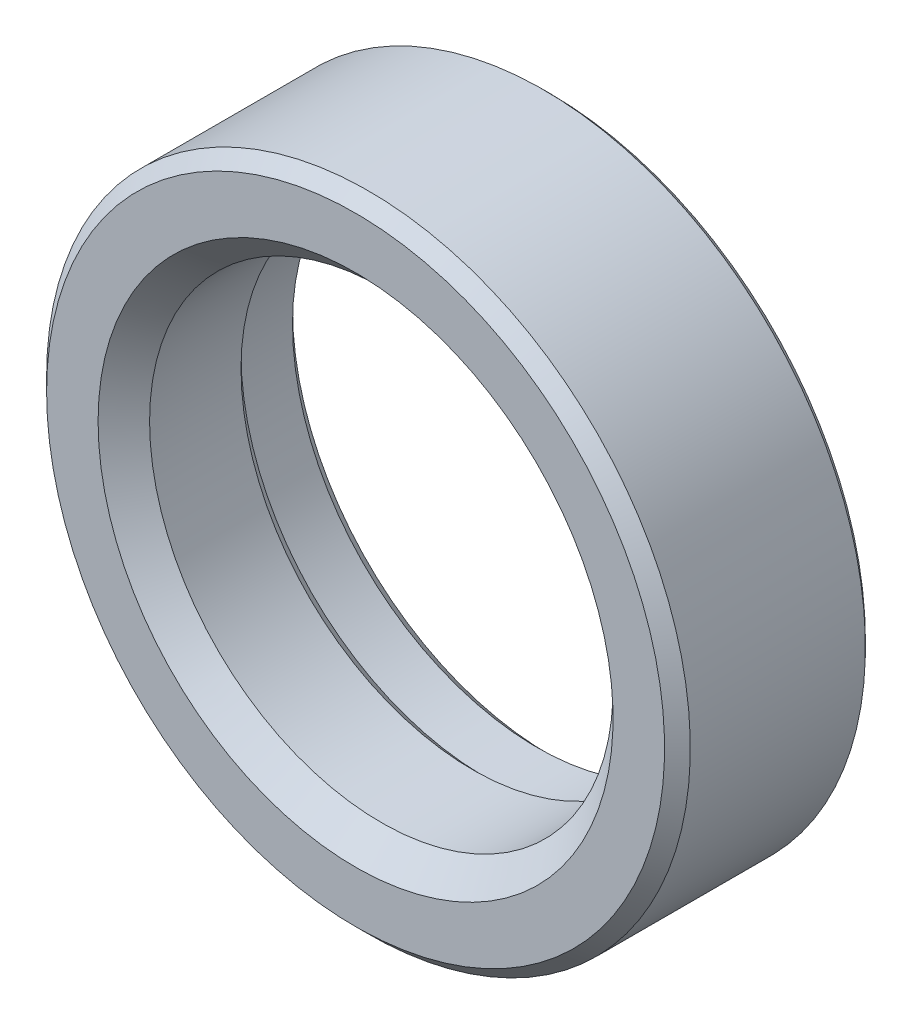
from build123d import *

# Parameters (mm, degrees)
CROQUIS4_R            = 19
CORTAR_EXTRUIR1_DEPTH = 5
CHAFL_N1_SIZE         = 1
CHAFL_N2_SIZE         = 0.5
CHAFL_N3_SIZE         = 1
CROQUIS5_R            = 1.25
CORTAR_EXTRUIR2_DEPTH = 7.5
CHAFL_N4_SIZE         = 0.2


with BuildPart() as part:
    # Croquis1 → Revolución2 (revolve)
    with BuildSketch(Plane(origin=(0, 0, 0), x_dir=(0, 0, -1), z_dir=(1, 0, 0)), mode=Mode.PRIVATE) as revoluci_n2_sk:
        Polygon((-5.505325444, 0), (7.594674556, 0), (7.594674556, 7), (-6.505325444, 7), (-7.505325444, 6), (-7.505325444, 2), align=None)
    revolve(revoluci_n2_sk.sketch.rotate(Axis((0, -18, -7.594674556), (0, 0, 1)), 90), axis=Axis((0, -18, -7.594674556), (0, 0, 1)))

    # Croquis4 → Cortar-Extruir1 (cut)
    with BuildSketch(Plane(origin=(0, 0, -7.594674556), x_dir=(-1, 0, 0), z_dir=(0, 0, -1))):
        with Locations((0, -18)):
            Circle(CROQUIS4_R)
    extrude(amount=-CORTAR_EXTRUIR1_DEPTH, mode=Mode.SUBTRACT)

    # Chaflán1
    chafl_n1_edges = [part.edges().sort_by_distance(p)[0] for p in [
        (18, -18, -2.594674556),
    ]]
    chamfer(chafl_n1_edges, length=CHAFL_N1_SIZE - 0.0001)  # a hair under: the kernel refuses the full size

    # Chaflán2
    chafl_n2_edges = [part.edges().sort_by_distance(p)[0] for p in [
        (25, -18, -7.594674556),
    ]]
    chamfer(chafl_n2_edges, length=CHAFL_N2_SIZE)

    # Chaflán3
    chafl_n3_edges = [part.edges().sort_by_distance(p)[0] for p in [
        (19, -18, -7.594674556),
    ]]
    chamfer(chafl_n3_edges, length=CHAFL_N3_SIZE)

    # Croquis5 → Cortar-Extruir2 (cut)
    with BuildSketch(Plane(origin=(0, 0, -7.594674556), x_dir=(-1, 0, 0), z_dir=(0, 0, -1))):
        with Locations((0, 4)):
            Circle(CROQUIS5_R)
        with Locations((11, 1.052558883)):
            Circle(CROQUIS5_R)
        with Locations((19.052558883, -7)):
            Circle(CROQUIS5_R)
        with Locations((22, -18)):
            Circle(CROQUIS5_R)
        with Locations((19.052558883, -29)):
            Circle(CROQUIS5_R)
        with Locations((11, -37.052558883)):
            Circle(CROQUIS5_R)
        with Locations((0, -40)):
            Circle(CROQUIS5_R)
        with Locations((-11, -37.052558883)):
            Circle(CROQUIS5_R)
        with Locations((-19.052558883, -29)):
            Circle(CROQUIS5_R)
        with Locations((-22, -18)):
            Circle(CROQUIS5_R)
        with Locations((-19.052558883, -7)):
            Circle(CROQUIS5_R)
        with Locations((-11, 1.052558883)):
            Circle(CROQUIS5_R)
    extrude(amount=-CORTAR_EXTRUIR2_DEPTH, mode=Mode.SUBTRACT)

    # Chaflán4
    chafl_n4_edges = [part.edges().sort_by_distance(p)[0] for p in [
        (1.25, 4, -7.594674556),
        (12.25, 1.052558883, -7.594674556),
        (20.302558883, -7, -7.594674556),
        (23.25, -18, -7.594674556),
        (-9.75, 1.052558883, -7.594674556),
        (-17.802558883, -7, -7.594674556),
        (-20.75, -18, -7.594674556),
        (-17.802558883, -29, -7.594674556),
        (-9.75, -37.052558883, -7.594674556),
        (1.25, -40, -7.594674556),
        (12.25, -37.052558883, -7.594674556),
        (20.302558883, -29, -7.594674556),
    ]]
    chamfer(chafl_n4_edges, length=CHAFL_N4_SIZE)


solid = part.part
